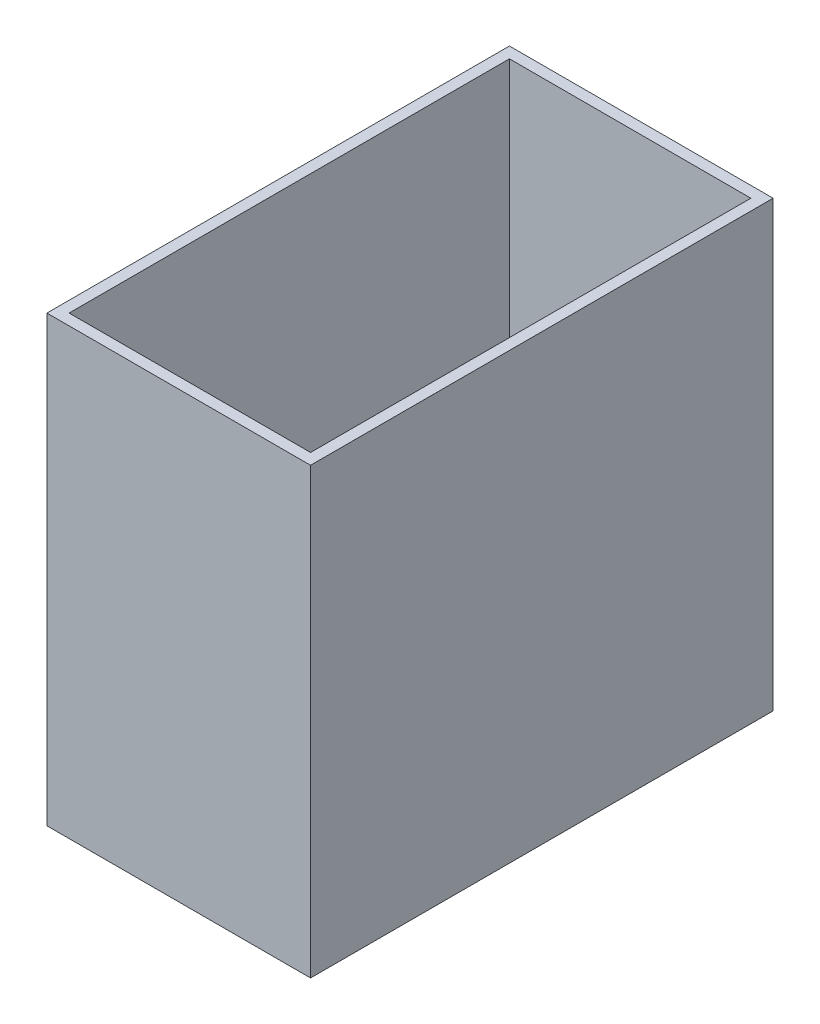
from build123d import *

# Parameters (mm, degrees)
ESBO_O1_W                = 142.5
ESBO_O1_H                = 250
RESSALTO_EXTRUS_O1_DEPTH = 240
ESBO_O2_W                = 130.5
ESBO_O2_H                = 238
CORTE_EXTRUS_O1_DEPTH    = 234


with BuildPart() as part:
    # Esboço1 → Ressalto-extrusão1 (new body)
    with BuildSketch(Plane(origin=(0, 0, 0), x_dir=(1, 0, 0), z_dir=(0, 1, 0))):
        with Locations((71.25, -125)):
            Rectangle(ESBO_O1_W, ESBO_O1_H)
    extrude(amount=RESSALTO_EXTRUS_O1_DEPTH)

    # Esboço2 → Corte-extrusão1 (cut)
    with BuildSketch(Plane(origin=(0, 240, 0), x_dir=(1, 0, 0), z_dir=(0, 1, 0))):
        with Locations((71.25, -125)):
            Rectangle(ESBO_O2_W, ESBO_O2_H)
    extrude(amount=-CORTE_EXTRUS_O1_DEPTH, mode=Mode.SUBTRACT)


solid = part.part
